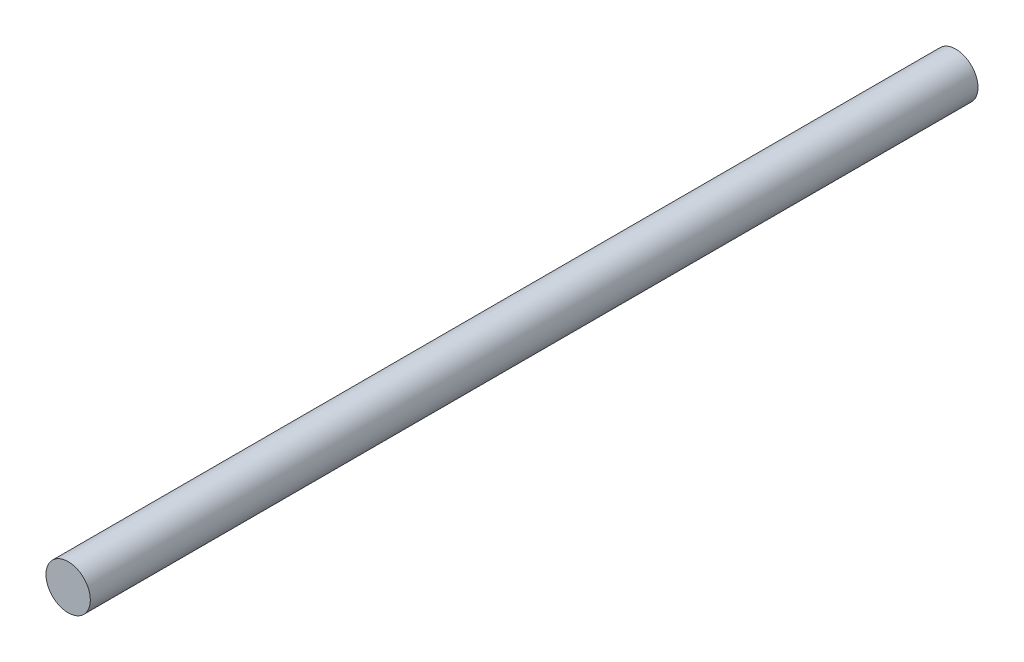
from build123d import *

# Parameters (mm, degrees)
EXTRUDE1_DEPTH      = 139.7
EXTRUDE1_DEPTH_BACK = 177.8
SKETCH1_R           = 7.9375


with BuildPart() as part:
    # Sketch1 → Extrude1 (new, two sides: drawn at the far end of the back side and taken through both)
    with BuildSketch(Plane.XY.offset(-EXTRUDE1_DEPTH_BACK)):
        Circle(SKETCH1_R)
    extrude(amount=EXTRUDE1_DEPTH + EXTRUDE1_DEPTH_BACK)


solid = part.part
